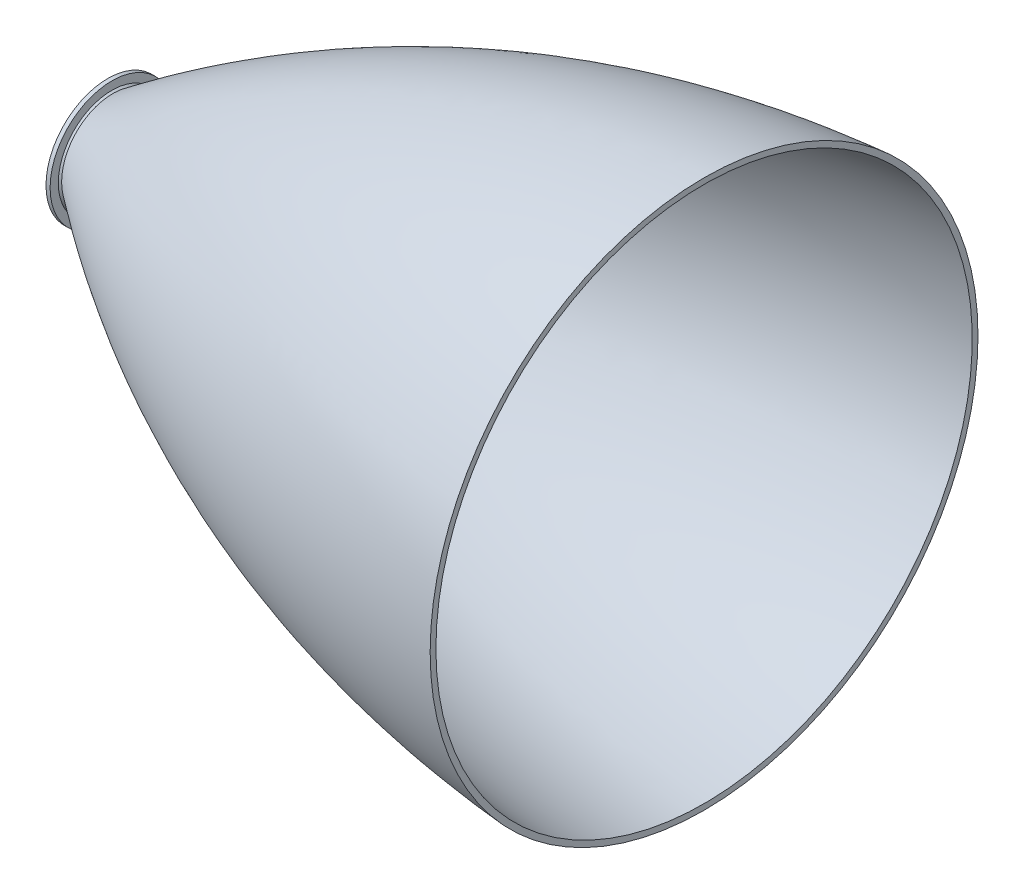
from build123d import *

# Parameters (mm, degrees)
SKETCH4_W           = 2299.140163329
SKETCH4_H           = 1084.867048291
CUT_EXTRUDE1_DEPTH  = 554.228
SKETCH5_R           = 95.504801646
SKETCH5_R_2         = 82.804801646
BOSS_EXTRUDE1_DEPTH = 6.35


with BuildPart() as part:
    # Sketch1 → Revolve3 (revolve)
    with BuildSketch(Plane.XY):
        with BuildLine():
            Line((914.4, 414.655), (914.4, 423.545))
            add(Edge.make_bspline(
                [(0, 78.994), (408.290095894, 383.61287022), (914.4, 423.545)],
                knots=[0, 0, 0, 1, 1, 1], degree=2))
            add(Edge.make_bspline(
                [(0, 78.994), (-192.730394607, 176.706088879), (-412.824178468, 153.699870936)],
                knots=[0, 0, 0, 1, 1, 1], degree=2))
            Line((-412.824178468, 153.699870936), (-412.824178468, 144.809870936))
            add(Edge.make_bspline(
                [(0, 70.104), (-195.449728047, 157.410787998), (-412.824178468, 144.809870936)],
                knots=[0, 0, 0, 1, 1, 1], degree=2))
            add(Edge.make_bspline(
                [(0, 70.104), (420.167251453, 366.631175918), (914.4, 414.655)],
                knots=[0, 0, 0, 1, 1, 1], degree=2))
        make_face()
    revolve(axis=Axis((-1229.828239288, 0, 0), (1, 0, 0)))

    # Sketch4 → Cut-Extrude1 (cut)
    with BuildSketch(Plane.ZY.offset(7.62)):
        with Locations((-63.658537287, 96.480710784)):
            Rectangle(SKETCH4_W, SKETCH4_H)
    extrude(amount=CUT_EXTRUDE1_DEPTH, mode=Mode.SUBTRACT)


with BuildPart() as body_2:
    # Sketch5 → Boss-Extrude1 (new body)
    with BuildSketch(Plane.ZY.offset(7.62)):
        Circle(SKETCH5_R)
        Circle(SKETCH5_R_2, mode=Mode.SUBTRACT)
    extrude(amount=-BOSS_EXTRUDE1_DEPTH)


solid = Compound([part.part, body_2.part])
